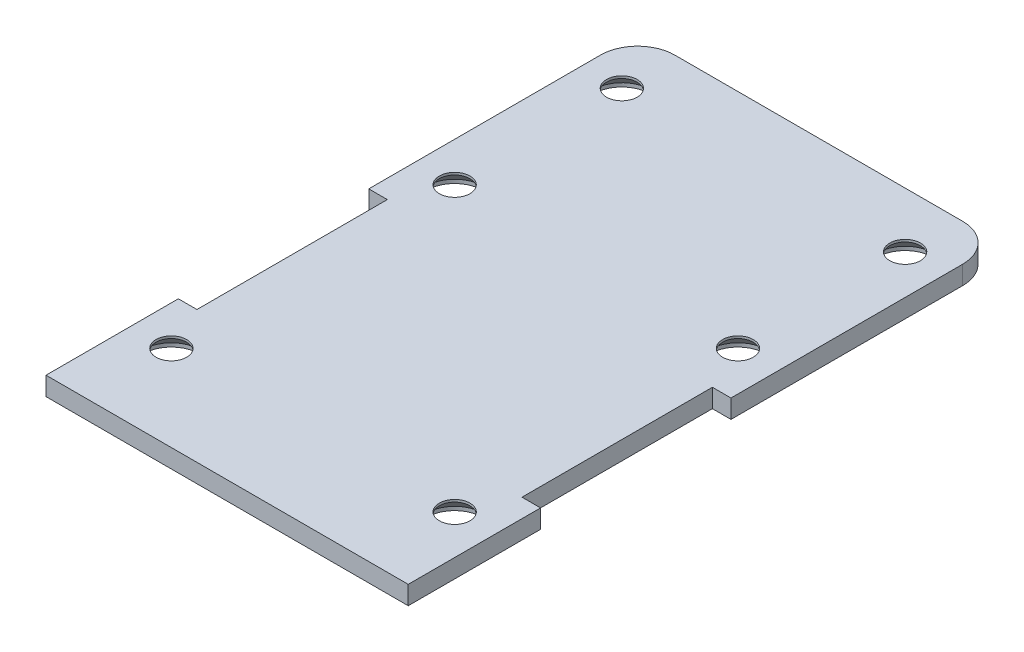
from build123d import *

# Parameters (mm, degrees)
SKETCH1_W            = 36
SKETCH1_H            = 62.2
BASE_SHAPE_DEPTH     = 2
CUTOUTS_REACH        = 37.989
SKETCH2_R            = 1.65
SKETCH2_W            = 0.5
SKETCH2_H            = 20.5
SKETCH3_W            = 1.5
SKETCH3_H            = 28.95
SKETCH3_H_2          = 12.75
EXTRA_SIZE_DEPTH     = 2
SKETCH4_R            = 3
SCREW_HEAD_CUT_DEPTH = 0.4
SCREW_CHAMFER_SIZE   = 1.35
FILLET1_R            = 4


with BuildPart() as part:
    # Sketch1 → Base shape (new body)
    with BuildSketch(Plane(origin=(0, 0, 0), x_dir=(1, 0, 0), z_dir=(0, 1, 0))):
        Rectangle(SKETCH1_W, SKETCH1_H)
    extrude(amount=BASE_SHAPE_DEPTH)

    # Sketch2 → Cutouts (cut, up to next)
    with BuildSketch(Plane(origin=(0, 2, 0), x_dir=(1, 0, 0), z_dir=(0, 1, 0)), mode=Mode.PRIVATE) as cutouts_sk1:
        with Locations(Location((-15.25, 7.15, 0), (0, 0, 270))):
            Circle(SKETCH2_R)
    cutouts_tool1 = extrude(cutouts_sk1.sketch, amount=-CUTOUTS_REACH, mode=Mode.PRIVATE) & part.part
    # Sketch2 → Cutouts (cut, up to next)
    with BuildSketch(Plane(origin=(0, 2, 0), x_dir=(1, 0, 0), z_dir=(0, 1, 0)), mode=Mode.PRIVATE) as cutouts_sk2:
        with Locations(Location((15.25, 7.15, 0), (0, 0, 270))):
            Circle(SKETCH2_R)
    cutouts_tool2 = extrude(cutouts_sk2.sketch, amount=-CUTOUTS_REACH, mode=Mode.PRIVATE) & part.part
    # Sketch2 → Cutouts (cut, up to next)
    with BuildSketch(Plane(origin=(0, 2, 0), x_dir=(1, 0, 0), z_dir=(0, 1, 0)), mode=Mode.PRIVATE) as cutouts_sk3:
        with Locations((17.75, -8.1)):
            Rectangle(SKETCH2_W, SKETCH2_H)
    cutouts_tool3 = extrude(cutouts_sk3.sketch, amount=-CUTOUTS_REACH, mode=Mode.PRIVATE) & part.part
    # Sketch2 → Cutouts (cut, up to next)
    with BuildSketch(Plane(origin=(0, 2, 0), x_dir=(1, 0, 0), z_dir=(0, 1, 0)), mode=Mode.PRIVATE) as cutouts_sk4:
        with Locations((-17.75, -8.1)):
            Rectangle(SKETCH2_W, SKETCH2_H)
    cutouts_tool4 = extrude(cutouts_sk4.sketch, amount=-CUTOUTS_REACH, mode=Mode.PRIVATE) & part.part
    # Sketch2 → Cutouts (cut, up to next)
    with BuildSketch(Plane(origin=(0, 2, 0), x_dir=(1, 0, 0), z_dir=(0, 1, 0)), mode=Mode.PRIVATE) as cutouts_sk5:
        with Locations(Location((-15.25, -23.35, 0), (0, 0, 270))):
            Circle(SKETCH2_R)
    cutouts_tool5 = extrude(cutouts_sk5.sketch, amount=-CUTOUTS_REACH, mode=Mode.PRIVATE) & part.part
    # Sketch2 → Cutouts (cut, up to next)
    with BuildSketch(Plane(origin=(0, 2, 0), x_dir=(1, 0, 0), z_dir=(0, 1, 0)), mode=Mode.PRIVATE) as cutouts_sk6:
        with Locations(Location((15.25, -23.35, 0), (0, 0, 270))):
            Circle(SKETCH2_R)
    cutouts_tool6 = extrude(cutouts_sk6.sketch, amount=-CUTOUTS_REACH, mode=Mode.PRIVATE) & part.part
    # Sketch2 → Cutouts (cut, up to next)
    with BuildSketch(Plane(origin=(0, 2, 0), x_dir=(1, 0, 0), z_dir=(0, 1, 0)), mode=Mode.PRIVATE) as cutouts_sk7:
        with Locations(Location((-15.25, 25.15, 0), (0, 0, 270))):
            Circle(SKETCH2_R)
    cutouts_tool7 = extrude(cutouts_sk7.sketch, amount=-CUTOUTS_REACH, mode=Mode.PRIVATE) & part.part
    # Sketch2 → Cutouts (cut, up to next)
    with BuildSketch(Plane(origin=(0, 2, 0), x_dir=(1, 0, 0), z_dir=(0, 1, 0)), mode=Mode.PRIVATE) as cutouts_sk8:
        with Locations(Location((15.25, 25.15, 0), (0, 0, 270))):
            Circle(SKETCH2_R)
    cutouts_tool8 = extrude(cutouts_sk8.sketch, amount=-CUTOUTS_REACH, mode=Mode.PRIVATE) & part.part
    add(cutouts_tool1.solids().sort_by_distance((-15.25, 2, -7.15))[0], mode=Mode.SUBTRACT)
    add(cutouts_tool2.solids().sort_by_distance((15.25, 2, -7.15))[0], mode=Mode.SUBTRACT)
    add(cutouts_tool3.solids().sort_by_distance((17.75, 2, 8.1))[0], mode=Mode.SUBTRACT)
    add(cutouts_tool4.solids().sort_by_distance((-17.75, 2, 8.1))[0], mode=Mode.SUBTRACT)
    add(cutouts_tool5.solids().sort_by_distance((-15.25, 2, 23.35))[0], mode=Mode.SUBTRACT)
    add(cutouts_tool6.solids().sort_by_distance((15.25, 2, 23.35))[0], mode=Mode.SUBTRACT)
    add(cutouts_tool7.solids().sort_by_distance((-15.25, 2, -25.15))[0], mode=Mode.SUBTRACT)
    add(cutouts_tool8.solids().sort_by_distance((15.25, 2, -25.15))[0], mode=Mode.SUBTRACT)

    # Sketch3 → Extra size (add)
    with BuildSketch(Plane.XZ):
        with Locations((-18.75, -16.625)):
            Rectangle(SKETCH3_W, SKETCH3_H)
        with Locations((18.75, -16.625)):
            Rectangle(SKETCH3_W, SKETCH3_H)
        with Locations((-18.75, 24.725)):
            Rectangle(SKETCH3_W, SKETCH3_H_2)
        with Locations((18.75, 24.725)):
            Rectangle(SKETCH3_W, SKETCH3_H_2)
        Polygon((19.5, 31.1), (19.5, 32.6), (-19.5, 32.6), (-19.5, 31.1), (-18, 31.1), (18, 31.1), align=None)
    extrude(amount=-EXTRA_SIZE_DEPTH)

    # Sketch4 → Screw head cut (cut)
    with BuildSketch(Plane(origin=(0, 0, 0), x_dir=(1, 0, 0), z_dir=(0, 1, 0))):
        with Locations(Location((-15.25, 25.15, 0), (0, 0, 270))):
            Circle(SKETCH4_R)
        with Locations(Location((15.25, 25.15, 0), (0, 0, 270))):
            Circle(SKETCH4_R)
        with Locations(Location((15.25, 7.15, 0), (0, 0, 270))):
            Circle(SKETCH4_R)
        with Locations(Location((-15.25, 7.15, 0), (0, 0, 270))):
            Circle(SKETCH4_R)
        with Locations(Location((-15.25, -23.35, 0), (0, 0, 270))):
            Circle(SKETCH4_R)
        with Locations(Location((15.25, -23.35, 0), (0, 0, 270))):
            Circle(SKETCH4_R)
    extrude(amount=SCREW_HEAD_CUT_DEPTH, mode=Mode.SUBTRACT)

    # Screw chamfer
    screw_chamfer_edges = [part.edges().sort_by_distance(p)[0] for p in [
        (-15.25, 0.4, -26.8),
        (15.25, 0.4, 21.7),
        (-15.25, 0.4, 21.7),
        (-15.25, 0.4, -8.8),
        (15.25, 0.4, -8.8),
        (15.25, 0.4, -26.8),
    ]]
    chamfer(screw_chamfer_edges, length=SCREW_CHAMFER_SIZE - 0.0001)  # a hair under: the kernel refuses the full size

    # Fillet1
    fillet1_edges = [part.edges().sort_by_distance(p)[0] for p in [
        (-19.5, 1, -31.1),
        (19.5, 1, -31.1),
    ]]
    fillet(fillet1_edges, radius=FILLET1_R)


solid = part.part
